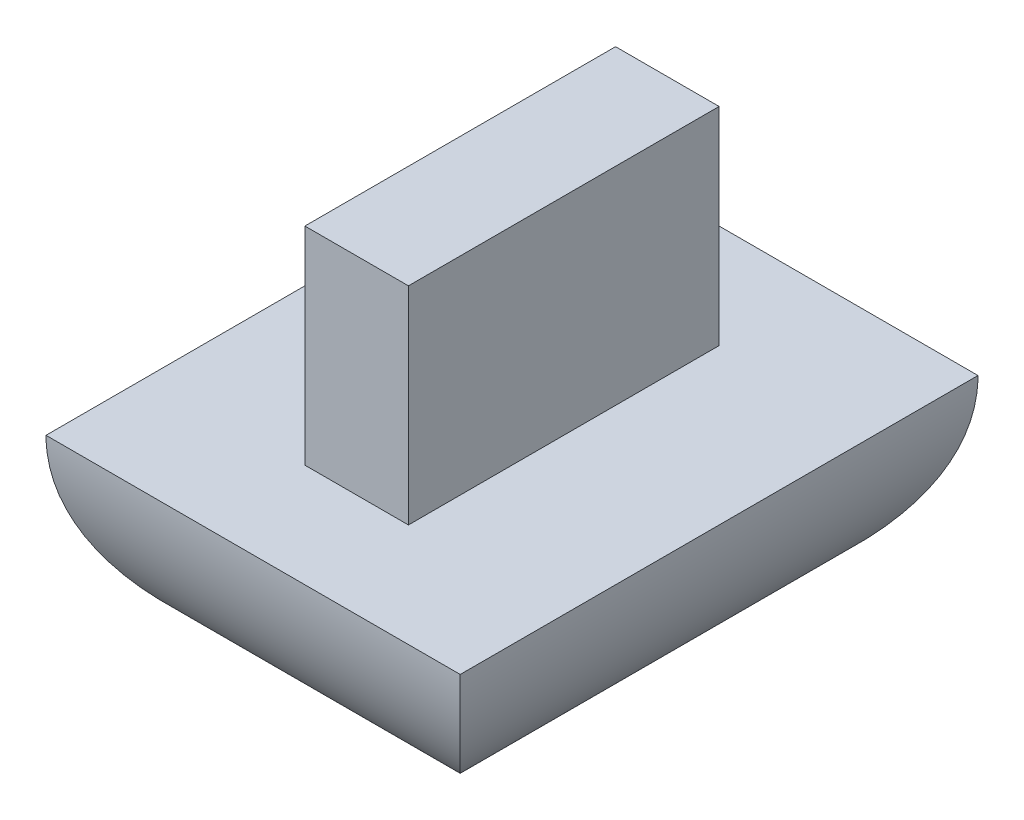
from build123d import *

# Parameters (mm, degrees)
SKETCH1_W           = 6.35
SKETCH1_H           = 7.9375
BOSS_EXTRUDE1_DEPTH = 3.175
SKETCH1_3_W         = 1.5875
SKETCH1_3_H         = 4.7625
BOSS_EXTRUDE2_DEPTH = 3.175
FILLET1_R           = 3.175


with BuildPart() as part:
    # Sketch1 → Boss-Extrude1 (new body)
    with BuildSketch(Plane(origin=(0, 0, 0), x_dir=(1, 0, 0), z_dir=(0, 1, 0))):
        with Locations((3.175, 3.96875)):
            Rectangle(SKETCH1_W, SKETCH1_H)
    extrude(amount=-BOSS_EXTRUDE1_DEPTH)

    # Sketch1<3> → Boss-Extrude2 (add)
    with BuildSketch(Plane(origin=(0, 0, 0), x_dir=(1, 0, 0), z_dir=(0, 1, 0))):
        with Locations((3.175, 3.96875)):
            Rectangle(SKETCH1_3_W, SKETCH1_3_H)
    extrude(amount=BOSS_EXTRUDE2_DEPTH)

    # Fillet1
    fillet1_edges = [part.edges().sort_by_distance(p)[0] for p in [
        (6.35, -3.175, -3.96875),
        (3.175, -3.175, -7.9375),
        (0, -3.175, -3.96875),
        (3.175, -3.175, 0),
    ]]
    fillet(fillet1_edges, radius=FILLET1_R - 0.0001)  # a hair under: the kernel refuses the full size


solid = part.part
